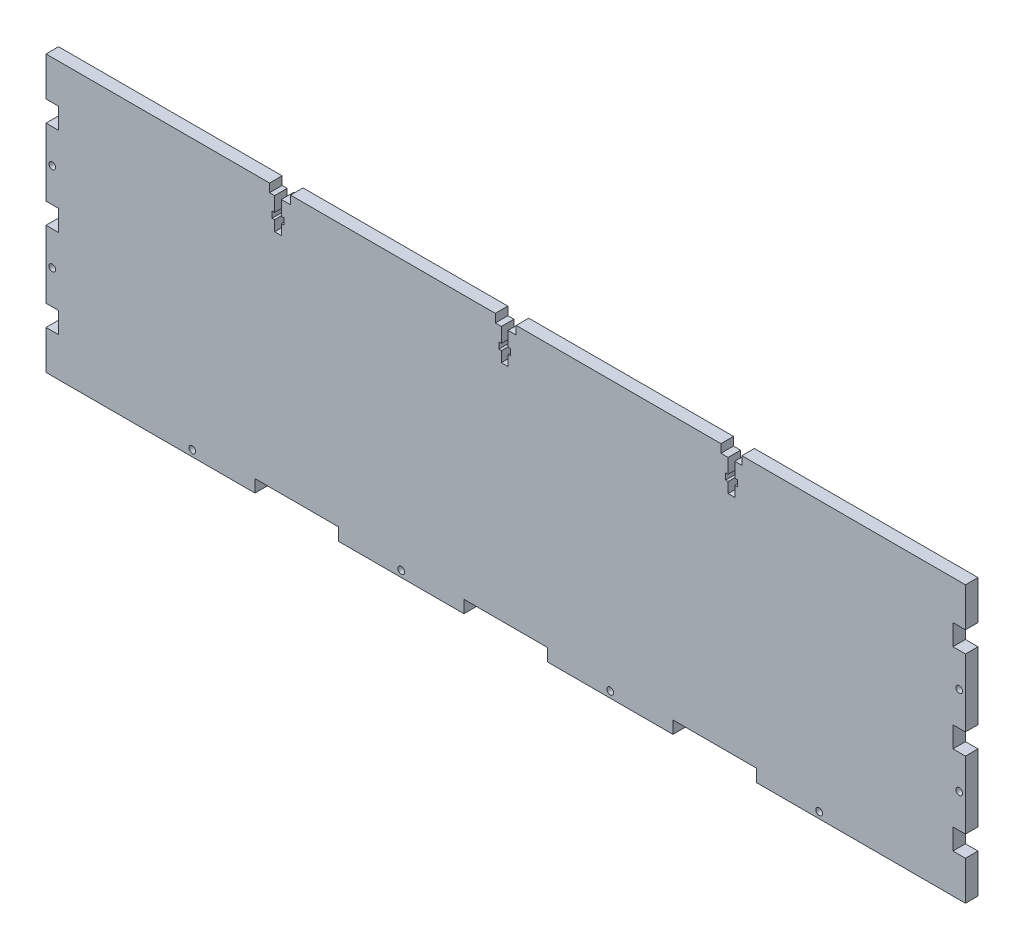
from build123d import *

# Parameters (mm, degrees)
SKETCH1_W           = 440
SKETCH1_H           = 132
BOSS_EXTRUDE1_DEPTH = 6
CUT_EXTRUDE1_REACH  = 231.765
SKETCH2_R           = 1.6
SKETCH2_W           = 6
SKETCH2_H           = 10
CUT_EXTRUDE2_REACH  = 231.765
SKETCH3_R           = 1.6
CUT_EXTRUDE3_REACH  = 231.765
SKETCH4_W           = 40
SKETCH4_H           = 6
SKETCH5_W           = 10
SKETCH5_H           = 6
CUT_EXTRUDE4_DEPTH  = 4
CUT_EXTRUDE5_REACH  = 231.765


with BuildPart() as part:
    # Sketch1 → Boss-Extrude1 (new body)
    with BuildSketch(Plane.XY):
        Rectangle(SKETCH1_W, SKETCH1_H)
    extrude(amount=BOSS_EXTRUDE1_DEPTH)

    # Sketch2 → Cut-Extrude1 (cut, up to next)
    with BuildSketch(Plane(origin=(0, 0, 0), x_dir=(-1, 0, 0), z_dir=(0, 0, -1)), mode=Mode.PRIVATE) as cut_extrude1_sk1:
        with Locations((217, 21.166064391)):
            Circle(SKETCH2_R)
    cut_extrude1_tool1 = extrude(cut_extrude1_sk1.sketch, amount=-CUT_EXTRUDE1_REACH, mode=Mode.PRIVATE) & part.part
    # Sketch2 → Cut-Extrude1 (cut, up to next)
    with BuildSketch(Plane(origin=(0, 0, 0), x_dir=(-1, 0, 0), z_dir=(0, 0, -1)), mode=Mode.PRIVATE) as cut_extrude1_sk2:
        with Locations((217, -21.166064391)):
            Circle(SKETCH2_R)
    cut_extrude1_tool2 = extrude(cut_extrude1_sk2.sketch, amount=-CUT_EXTRUDE1_REACH, mode=Mode.PRIVATE) & part.part
    # Sketch2 → Cut-Extrude1 (cut, up to next)
    with BuildSketch(Plane(origin=(0, 0, 0), x_dir=(-1, 0, 0), z_dir=(0, 0, -1)), mode=Mode.PRIVATE) as cut_extrude1_sk3:
        with Locations((-217, 21.166064391)):
            Circle(SKETCH2_R)
    cut_extrude1_tool3 = extrude(cut_extrude1_sk3.sketch, amount=-CUT_EXTRUDE1_REACH, mode=Mode.PRIVATE) & part.part
    # Sketch2 → Cut-Extrude1 (cut, up to next)
    with BuildSketch(Plane(origin=(0, 0, 0), x_dir=(-1, 0, 0), z_dir=(0, 0, -1)), mode=Mode.PRIVATE) as cut_extrude1_sk4:
        with Locations((-217, -21.166064391)):
            Circle(SKETCH2_R)
    cut_extrude1_tool4 = extrude(cut_extrude1_sk4.sketch, amount=-CUT_EXTRUDE1_REACH, mode=Mode.PRIVATE) & part.part
    # Sketch2 → Cut-Extrude1 (cut, up to next)
    with BuildSketch(Plane(origin=(0, 0, 0), x_dir=(-1, 0, 0), z_dir=(0, 0, -1)), mode=Mode.PRIVATE) as cut_extrude1_sk5:
        with Locations((217, 42.332128782)):
            Rectangle(SKETCH2_W, SKETCH2_H)
    cut_extrude1_tool5 = extrude(cut_extrude1_sk5.sketch, amount=-CUT_EXTRUDE1_REACH, mode=Mode.PRIVATE) & part.part
    # Sketch2 → Cut-Extrude1 (cut, up to next)
    with BuildSketch(Plane(origin=(0, 0, 0), x_dir=(-1, 0, 0), z_dir=(0, 0, -1)), mode=Mode.PRIVATE) as cut_extrude1_sk6:
        with Locations((217, -42.332128782)):
            Rectangle(SKETCH2_W, SKETCH2_H)
    cut_extrude1_tool6 = extrude(cut_extrude1_sk6.sketch, amount=-CUT_EXTRUDE1_REACH, mode=Mode.PRIVATE) & part.part
    # Sketch2 → Cut-Extrude1 (cut, up to next)
    with BuildSketch(Plane(origin=(0, 0, 0), x_dir=(-1, 0, 0), z_dir=(0, 0, -1)), mode=Mode.PRIVATE) as cut_extrude1_sk7:
        with Locations((-217, -42.332128782)):
            Rectangle(SKETCH2_W, SKETCH2_H)
    cut_extrude1_tool7 = extrude(cut_extrude1_sk7.sketch, amount=-CUT_EXTRUDE1_REACH, mode=Mode.PRIVATE) & part.part
    # Sketch2 → Cut-Extrude1 (cut, up to next)
    with BuildSketch(Plane(origin=(0, 0, 0), x_dir=(-1, 0, 0), z_dir=(0, 0, -1)), mode=Mode.PRIVATE) as cut_extrude1_sk8:
        with Locations((-217, 42.332128782)):
            Rectangle(SKETCH2_W, SKETCH2_H)
    cut_extrude1_tool8 = extrude(cut_extrude1_sk8.sketch, amount=-CUT_EXTRUDE1_REACH, mode=Mode.PRIVATE) & part.part
    # Sketch2 → Cut-Extrude1 (cut, up to next)
    with BuildSketch(Plane(origin=(0, 0, 0), x_dir=(-1, 0, 0), z_dir=(0, 0, -1)), mode=Mode.PRIVATE) as cut_extrude1_sk9:
        with Locations((217, 0)):
            Rectangle(SKETCH2_W, SKETCH2_H)
    cut_extrude1_tool9 = extrude(cut_extrude1_sk9.sketch, amount=-CUT_EXTRUDE1_REACH, mode=Mode.PRIVATE) & part.part
    # Sketch2 → Cut-Extrude1 (cut, up to next)
    with BuildSketch(Plane(origin=(0, 0, 0), x_dir=(-1, 0, 0), z_dir=(0, 0, -1)), mode=Mode.PRIVATE) as cut_extrude1_sk10:
        with Locations((-217, 0)):
            Rectangle(SKETCH2_W, SKETCH2_H)
    cut_extrude1_tool10 = extrude(cut_extrude1_sk10.sketch, amount=-CUT_EXTRUDE1_REACH, mode=Mode.PRIVATE) & part.part
    add(cut_extrude1_tool1.solids().sort_by_distance((-217, 21.166064, 0))[0], mode=Mode.SUBTRACT)
    add(cut_extrude1_tool2.solids().sort_by_distance((-217, -21.166064, 0))[0], mode=Mode.SUBTRACT)
    add(cut_extrude1_tool3.solids().sort_by_distance((217, 21.166064, 0))[0], mode=Mode.SUBTRACT)
    add(cut_extrude1_tool4.solids().sort_by_distance((217, -21.166064, 0))[0], mode=Mode.SUBTRACT)
    add(cut_extrude1_tool5.solids().sort_by_distance((-217, 42.332129, 0))[0], mode=Mode.SUBTRACT)
    add(cut_extrude1_tool6.solids().sort_by_distance((-217, -42.332129, 0))[0], mode=Mode.SUBTRACT)
    add(cut_extrude1_tool7.solids().sort_by_distance((217, -42.332129, 0))[0], mode=Mode.SUBTRACT)
    add(cut_extrude1_tool8.solids().sort_by_distance((217, 42.332129, 0))[0], mode=Mode.SUBTRACT)
    add(cut_extrude1_tool9.solids().sort_by_distance((-217, 0, 0))[0], mode=Mode.SUBTRACT)
    add(cut_extrude1_tool10.solids().sort_by_distance((217, 0, 0))[0], mode=Mode.SUBTRACT)

    # Sketch3 → Cut-Extrude2 (cut, up to next)
    with BuildSketch(Plane(origin=(0, 0, 0), x_dir=(-1, 0, 0), z_dir=(0, 0, -1)), mode=Mode.PRIVATE) as cut_extrude2_sk1:
        with Locations((-150, -63)):
            Circle(SKETCH3_R)
    cut_extrude2_tool1 = extrude(cut_extrude2_sk1.sketch, amount=-CUT_EXTRUDE2_REACH, mode=Mode.PRIVATE) & part.part
    # Sketch3 → Cut-Extrude2 (cut, up to next)
    with BuildSketch(Plane(origin=(0, 0, 0), x_dir=(-1, 0, 0), z_dir=(0, 0, -1)), mode=Mode.PRIVATE) as cut_extrude2_sk2:
        with Locations((-50, -63)):
            Circle(SKETCH3_R)
    cut_extrude2_tool2 = extrude(cut_extrude2_sk2.sketch, amount=-CUT_EXTRUDE2_REACH, mode=Mode.PRIVATE) & part.part
    # Sketch3 → Cut-Extrude2 (cut, up to next)
    with BuildSketch(Plane(origin=(0, 0, 0), x_dir=(-1, 0, 0), z_dir=(0, 0, -1)), mode=Mode.PRIVATE) as cut_extrude2_sk3:
        with Locations((50, -63)):
            Circle(SKETCH3_R)
    cut_extrude2_tool3 = extrude(cut_extrude2_sk3.sketch, amount=-CUT_EXTRUDE2_REACH, mode=Mode.PRIVATE) & part.part
    # Sketch3 → Cut-Extrude2 (cut, up to next)
    with BuildSketch(Plane(origin=(0, 0, 0), x_dir=(-1, 0, 0), z_dir=(0, 0, -1)), mode=Mode.PRIVATE) as cut_extrude2_sk4:
        with Locations((150, -63)):
            Circle(SKETCH3_R)
    cut_extrude2_tool4 = extrude(cut_extrude2_sk4.sketch, amount=-CUT_EXTRUDE2_REACH, mode=Mode.PRIVATE) & part.part
    add(cut_extrude2_tool1.solids().sort_by_distance((150, -63, 0))[0], mode=Mode.SUBTRACT)
    add(cut_extrude2_tool2.solids().sort_by_distance((50, -63, 0))[0], mode=Mode.SUBTRACT)
    add(cut_extrude2_tool3.solids().sort_by_distance((-50, -63, 0))[0], mode=Mode.SUBTRACT)
    add(cut_extrude2_tool4.solids().sort_by_distance((-150, -63, 0))[0], mode=Mode.SUBTRACT)

    # Sketch4 → Cut-Extrude3 (cut, up to next)
    with BuildSketch(Plane(origin=(0, 0, 0), x_dir=(-1, 0, 0), z_dir=(0, 0, -1)), mode=Mode.PRIVATE) as cut_extrude3_sk1:
        with Locations((100, -63)):
            Rectangle(SKETCH4_W, SKETCH4_H)
    cut_extrude3_tool1 = extrude(cut_extrude3_sk1.sketch, amount=-CUT_EXTRUDE3_REACH, mode=Mode.PRIVATE) & part.part
    # Sketch4 → Cut-Extrude3 (cut, up to next)
    with BuildSketch(Plane(origin=(0, 0, 0), x_dir=(-1, 0, 0), z_dir=(0, 0, -1)), mode=Mode.PRIVATE) as cut_extrude3_sk2:
        with Locations((0, -63)):
            Rectangle(SKETCH4_W, SKETCH4_H)
    cut_extrude3_tool2 = extrude(cut_extrude3_sk2.sketch, amount=-CUT_EXTRUDE3_REACH, mode=Mode.PRIVATE) & part.part
    # Sketch4 → Cut-Extrude3 (cut, up to next)
    with BuildSketch(Plane(origin=(0, 0, 0), x_dir=(-1, 0, 0), z_dir=(0, 0, -1)), mode=Mode.PRIVATE) as cut_extrude3_sk3:
        with Locations((-100, -63)):
            Rectangle(SKETCH4_W, SKETCH4_H)
    cut_extrude3_tool3 = extrude(cut_extrude3_sk3.sketch, amount=-CUT_EXTRUDE3_REACH, mode=Mode.PRIVATE) & part.part
    add(cut_extrude3_tool1.solids().sort_by_distance((-100, -63, 0))[0], mode=Mode.SUBTRACT)
    add(cut_extrude3_tool2.solids().sort_by_distance((0, -63, 0))[0], mode=Mode.SUBTRACT)
    add(cut_extrude3_tool3.solids().sort_by_distance((100, -63, 0))[0], mode=Mode.SUBTRACT)

    # Sketch5 → Cut-Extrude4 (cut)
    with BuildSketch(Plane(origin=(0, 66, 0), x_dir=(1, 0, 0), z_dir=(0, 1, 0))):
        with Locations((-108, -3)):
            Rectangle(SKETCH5_W, SKETCH5_H)
        with Locations((0, -3)):
            Rectangle(SKETCH5_W, SKETCH5_H)
        with Locations((108, -3)):
            Rectangle(SKETCH5_W, SKETCH5_H)
    extrude(amount=-CUT_EXTRUDE4_DEPTH, mode=Mode.SUBTRACT)

    # Sketch6 → Cut-Extrude5 (cut, up to next)
    with BuildSketch(Plane(origin=(0, 0, 0), x_dir=(-1, 0, 0), z_dir=(0, 0, -1)), mode=Mode.PRIVATE) as cut_extrude5_sk1:
        Polygon((-109.6, 62), (-109.6, 55), (-110.8, 55), (-110.8, 52), (-109.6, 52), (-109.6, 47), (-106.4, 47), (-106.4, 52), (-105.2, 52), (-105.2, 55), (-106.4, 55), (-106.4, 62), align=None)
    cut_extrude5_tool1 = extrude(cut_extrude5_sk1.sketch, amount=-CUT_EXTRUDE5_REACH, mode=Mode.PRIVATE) & part.part
    # Sketch6 → Cut-Extrude5 (cut, up to next)
    with BuildSketch(Plane(origin=(0, 0, 0), x_dir=(-1, 0, 0), z_dir=(0, 0, -1)), mode=Mode.PRIVATE) as cut_extrude5_sk2:
        Polygon((-1.1, 62), (-1.1, 55), (-2.3, 55), (-2.3, 52), (-1.1, 52), (-1.1, 47), (2.1, 47), (2.1, 52), (3.3, 52), (3.3, 55), (2.1, 55), (2.1, 62), align=None)
    cut_extrude5_tool2 = extrude(cut_extrude5_sk2.sketch, amount=-CUT_EXTRUDE5_REACH, mode=Mode.PRIVATE) & part.part
    # Sketch6 → Cut-Extrude5 (cut, up to next)
    with BuildSketch(Plane(origin=(0, 0, 0), x_dir=(-1, 0, 0), z_dir=(0, 0, -1)), mode=Mode.PRIVATE) as cut_extrude5_sk3:
        Polygon((107.4, 62), (107.4, 55), (106.2, 55), (106.2, 52), (107.4, 52), (107.4, 47), (110.6, 47), (110.6, 52), (111.8, 52), (111.8, 55), (110.6, 55), (110.6, 62), align=None)
    cut_extrude5_tool3 = extrude(cut_extrude5_sk3.sketch, amount=-CUT_EXTRUDE5_REACH, mode=Mode.PRIVATE) & part.part
    add(cut_extrude5_tool1.solids().sort_by_distance((108, 54.369565, 0))[0], mode=Mode.SUBTRACT)
    add(cut_extrude5_tool2.solids().sort_by_distance((-0.5, 54.369565, 0))[0], mode=Mode.SUBTRACT)
    add(cut_extrude5_tool3.solids().sort_by_distance((-109, 54.369565, 0))[0], mode=Mode.SUBTRACT)


solid = part.part
